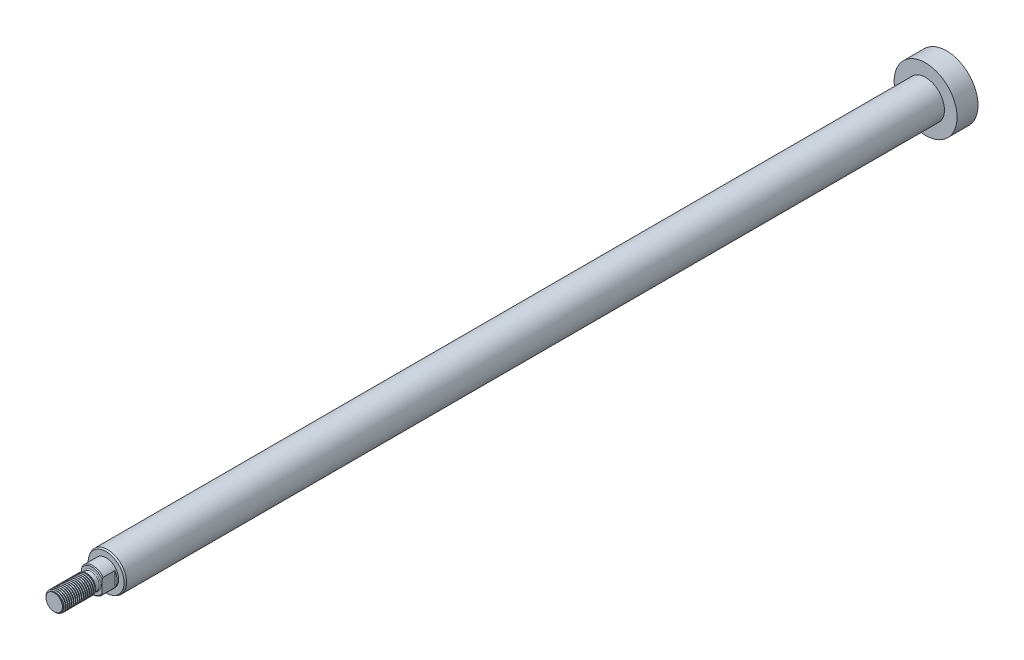
from build123d import *

# Parameters (mm, degrees)
CUT_EXTRUDE1_DEPTH      = 16
CUT_EXTRUDE1_DEPTH_BACK = 16
THREAD1_PITCH           = 1.25


with BuildPart() as part:
    # Sketch1 → Revolve1 (revolve)
    with BuildSketch(Plane(origin=(0, 0, 0), x_dir=(0, 0, -1), z_dir=(1, 0, 0)), mode=Mode.PRIVATE) as revolve1_sk:
        Polygon((-29.5, 0), (-29.5, 7.5), (-29, 8), (-20.5, 8), (-20.5, 11.422649731), (-19.5, 12), (500.666666667, 12), (500.666666667, 20), (514, 20), (514, 0), align=None)
    revolve(revolve1_sk.sketch.rotate(Axis((0, 0, -514), (0, 0, 1)), 270), axis=Axis((0, 0, -514), (0, 0, 1)))

    # Sketch2 → Cut-Extrude1 (cut, two sides: drawn at the far end of the back side and taken through both)
    with BuildSketch(Plane(origin=(0, 0, 0), x_dir=(1, 0, 0), z_dir=(0, 1, 0)).offset(-CUT_EXTRUDE1_DEPTH_BACK)):
        Polygon((-9.5, -21.5), (-9.5, -32.5), (9.5, -32.5), (9.5, -21.5), (6.5, -21.5), (6.5, -29.5), (-6.5, -29.5), (-6.5, -21.5), align=None)
    extrude(amount=CUT_EXTRUDE1_DEPTH + CUT_EXTRUDE1_DEPTH_BACK, mode=Mode.SUBTRACT)

    # Sketch3 → Revolve2 (revolve)
    with BuildSketch(Plane(origin=(0, 0, 0), x_dir=(0, 0, -1), z_dir=(1, 0, 0)), mode=Mode.PRIVATE) as revolve2_sk:
        with BuildLine():
            Line((-53.5, 0), (-53.5, 5.233))
            Line((-53.5, 5.233), (-52.733, 6))
            Line((-52.733, 6), (-33.267, 6))
            Line((-33.267, 6), (-32.5, 5.233))
            Line((-32.5, 5.233), (-30.1, 5.233))
            ThreePointArc((-30.1, 5.233), (-29.675735931, 5.408735931), (-29.5, 5.833))
            Line((-29.5, 5.833), (-29.5, 0))
            Line((-29.5, 0), (-53.5, 0))
        make_face()
    revolve(revolve2_sk.sketch.rotate(Axis((0, 0, 29.5), (0, 0, 1)), 270), axis=Axis((0, 0, 29.5), (0, 0, 1)))

    # Thread1: the profile of Thread Profile1 profile screwed along a right-hand helix of 20 turns, 8 arcs to a turn; built about Z, then put on its axis
    thread1_z = Axis((0, 0, 0), (0, 0, 1))
    thread1_corners = [(6.0003, 0, -0.000173205), (6.0003, 0, 1.093923202), (5.323417656, 0, 0.703124998), (5.323417656, 0, 0.390624998)]
    with BuildLine(mode=Mode.PRIVATE) as thread1_profile:
        Line(thread1_corners[0], thread1_corners[1])
        Line(thread1_corners[1], thread1_corners[2])
        Line(thread1_corners[2], thread1_corners[3])
        Line(thread1_corners[3], thread1_corners[0])
    thread1_cap = Face(thread1_profile.wire())
    thread1_turn_angles = [0, 22.5, 45, 67.5, 90, 112.5, 135, 157.5, 180, 202.5, 225, 247.5, 270, 292.5, 315, 337.5, 360]
    thread1_turn_weights = [1, 0.9238795325112867, 1, 0.9238795325112867, 1, 0.9238795325112867, 1, 0.9238795325112867, 1, 0.9238795325112867, 1, 0.9238795325112867, 1, 0.9238795325112867, 1, 0.9238795325112867, 1]
    thread1_turn_rails = [Edge.make_bspline([Vector(p[0], p[1], 0).rotate(thread1_z, thread1_turn_angles[k]) / thread1_turn_weights[k] + Vector(0, 0, p[2] + THREAD1_PITCH * thread1_turn_angles[k] / 360) for k in range(17)], [0, 0, 0, 1, 1, 2, 2, 3, 3, 4, 4, 5, 5, 6, 6, 7, 7, 8, 8, 8], 2, thread1_turn_weights) for p in thread1_corners]
    thread1_turn_sides = [Face.make_surface_from_curves(thread1_turn_rails[p[0]], thread1_turn_rails[p[1]]) for p in [(0, 1), (1, 2), (2, 3), (3, 0)]]
    thread1 = Plane(origin=(0, 0, 57.733), x_dir=(-1, 0, 0), z_dir=(0, 0, -1)) * Solid(Shell([*[p.moved(Location((0, 0, THREAD1_PITCH * i))) for i in range(20) for p in thread1_turn_sides], thread1_cap, thread1_cap.rotate(thread1_z, 7200).moved(Location((0, 0, THREAD1_PITCH * 7200 / 360)))]))
    add(thread1, mode=Mode.SUBTRACT)


solid = part.part
